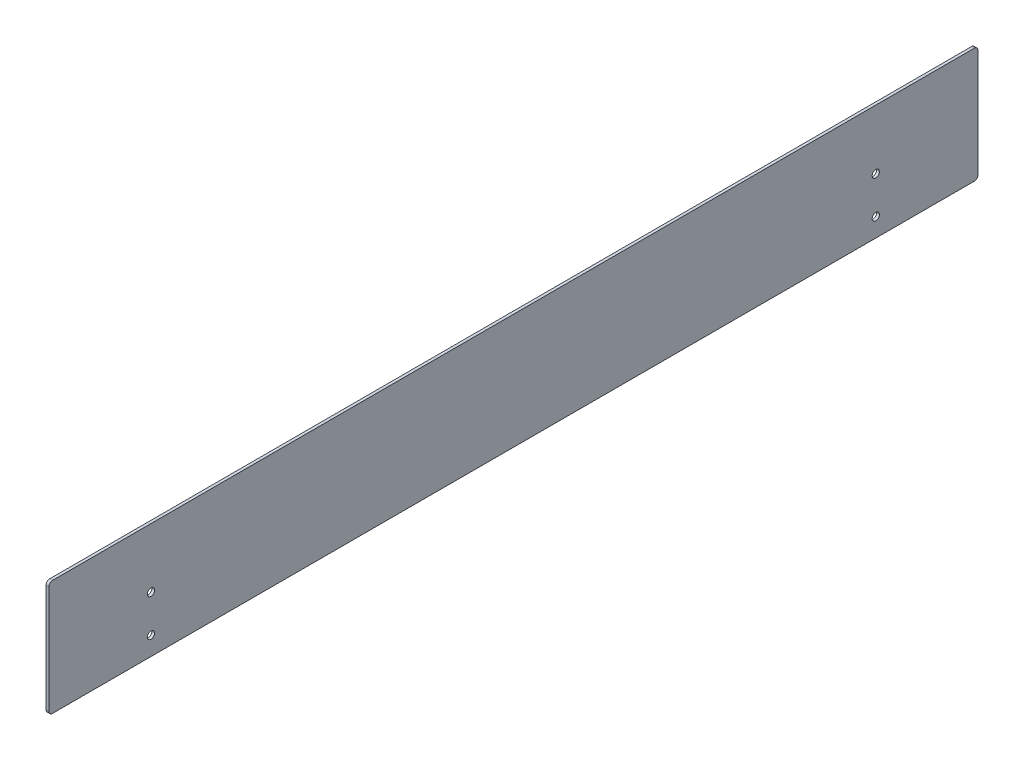
from build123d import *

# Parameters (mm, degrees)
SKETCH1_W           = 500
SKETCH1_H           = 62
SKETCH1_R           = 1.95
BOSS_EXTRUDE1_DEPTH = 1.5
FILLET1_R           = 2


with BuildPart() as part:
    # Sketch1 → Boss-Extrude1 (new body)
    with BuildSketch(Plane(origin=(0, 0, 0), x_dir=(0, 0, -1), z_dir=(1, 0, 0))):
        with Locations((-36.339345362, -109.292553191)):
            Rectangle(SKETCH1_W, SKETCH1_H)
        with Locations((158.660654638, -110.292553191)):
            Circle(SKETCH1_R, mode=Mode.SUBTRACT)
        with Locations((158.660654638, -130.292553191)):
            Circle(SKETCH1_R, mode=Mode.SUBTRACT)
        with Locations((-231.339345362, -110.292553191)):
            Circle(SKETCH1_R, mode=Mode.SUBTRACT)
        with Locations((-231.339345362, -130.292553191)):
            Circle(SKETCH1_R, mode=Mode.SUBTRACT)
    extrude(amount=BOSS_EXTRUDE1_DEPTH)

    # Fillet1
    fillet1_edges = [part.edges().sort_by_distance(p)[0] for p in [
        (0.75, -140.292553191, -213.660654638),
        (0.75, -78.292553191, -213.660654638),
        (0.75, -140.292553191, 286.339345362),
        (0.75, -78.292553191, 286.339345362),
    ]]
    fillet(fillet1_edges, radius=FILLET1_R)


solid = part.part
